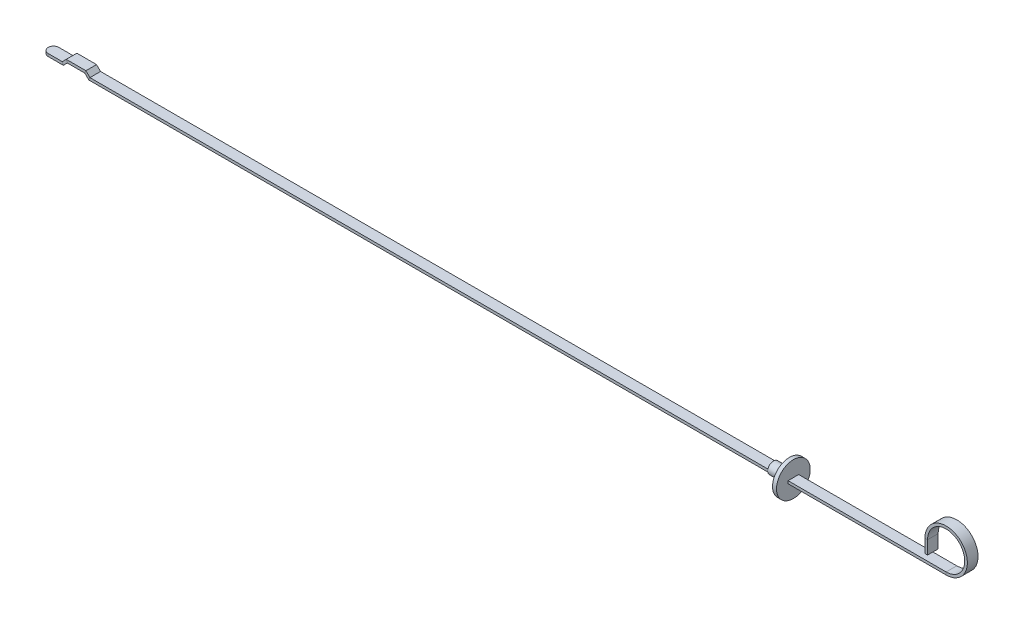
from build123d import *

# Parameters (mm, degrees)
SZKIC6_R                    = 12.7
DODANIE_WYCI_GNI_CIE3_DEPTH = 3
SZKIC7_W                    = 8
SZKIC7_H                    = 2
ZAOKR_GLENIE3_R             = 4


with BuildPart() as part:
    # Szkic5 → Obrót1 (revolve)
    with BuildSketch(Plane.XY):
        with BuildLine():
            Line((0, 6.35), (1, 6.35))
            ThreePointArc((1, 6.35), (2, 5.35), (3, 6.35))
            Line((3, 6.35), (3, 0))
            Line((3, 0), (0, 0))
            Line((0, 0), (-9, 0))
            Line((-9, 0), (-9, 4.35))
            Line((-9, 4.35), (0, 4.35))
            Line((0, 4.35), (0, 6.35))
        make_face()
    revolve(axis=Axis((0, 0, 0), (-1, 0, 0)))

    # Szkic6 → Dodanie-wyciągnięcie3 (add)
    with BuildSketch(Plane(origin=(3, 0, 0), x_dir=(0, 0, -1), z_dir=(1, 0, 0))):
        with Locations(Location((0, 0, 0), (0, 0, 90))):
            Circle(SZKIC6_R)
    extrude(amount=DODANIE_WYCI_GNI_CIE3_DEPTH)

    # Wyciągnięcie po ścieżce1: sweep along a path in Szkic1
    with BuildLine(Plane.XY) as wyci_gni_cie_po_cie_ce1_path:
        Line((110, 5), (110, 15))
        ThreePointArc((110, 15), (135.606601718, 25.606601718), (125, 0))
        Line((125, 0), (0, 0))
        Line((0, 0), (-520, 0))
        Line((-520, 0), (-523, 3))
        Line((-523, 3), (-537, 3))
        Line((-537, 3), (-540, 0))
        Line((-540, 0), (-555, 0))
    # Szkic7 → Wyciągnięcie po ścieżce1 (sweep)
    with BuildSketch(Plane(origin=(0, 0, 0), x_dir=(0, 0, -1), z_dir=(1, 0, 0))):
        Rectangle(SZKIC7_W, SZKIC7_H)
    sweep(path=wyci_gni_cie_po_cie_ce1_path.line, transition=Transition.RIGHT)

    # Zaokrąglenie3
    zaokr_glenie3_edges = [part.edges().sort_by_distance(p)[0] for p in [
        (-555, 0, -4),
        (-555, 0, 4),
    ]]
    fillet(zaokr_glenie3_edges, radius=ZAOKR_GLENIE3_R - 0.0001)  # a hair under: the kernel refuses the full size


solid = part.part
